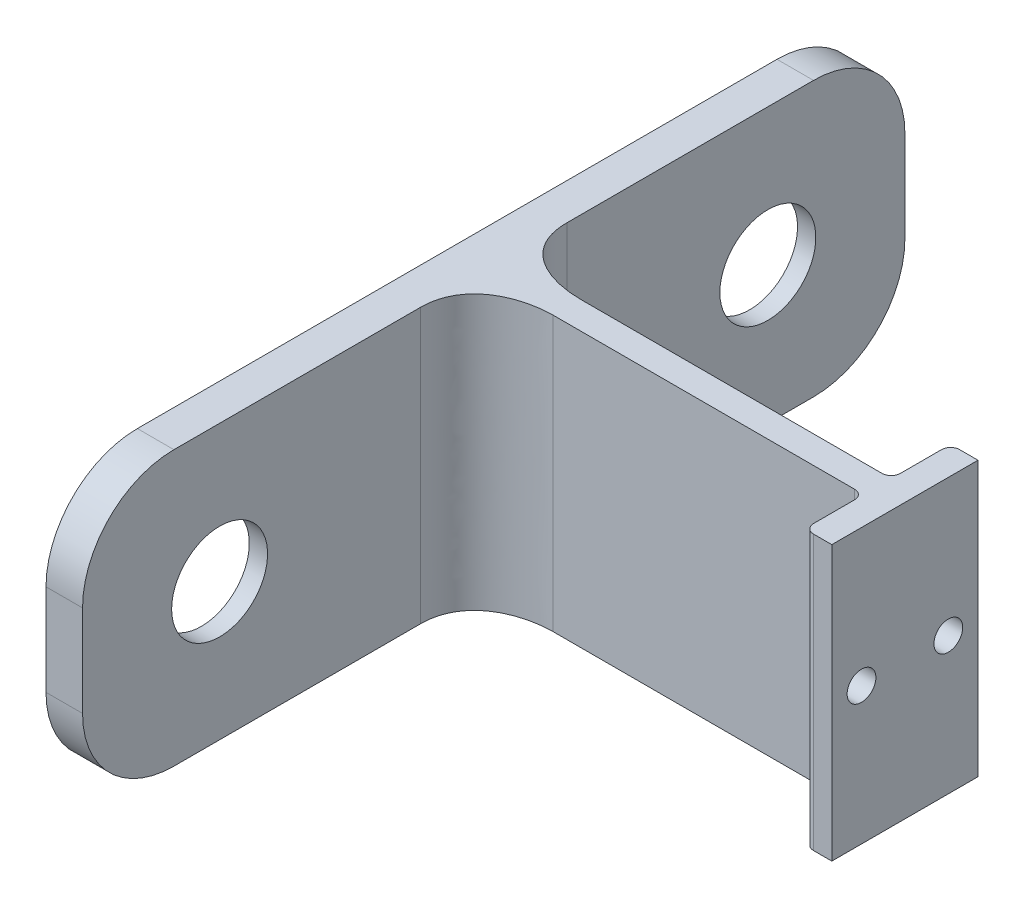
from build123d import *

# Parameters (mm, degrees)
SKETCH1_W                = 90
SKETCH1_H                = 30
BOSS_EXTRUDE1_DEPTH      = 4
FILLET1_R                = 10
SKETCH2_R                = 1.25
CUT_EXTRUDE1_DEPTH       = 48.602520942
SKETCH3_R                = 1.25
CUT_EXTRUDE2_DEPTH       = 48.602520942
SKETCH4_W                = 16
SKETCH4_H                = 30
BOSS_EXTRUDE5_DEPTH      = 3
SKETCH11_W               = 3
SKETCH11_H               = 30
BOSS_EXTRUDE6_DEPTH      = 39
SKETCH12_W               = 16
SKETCH12_H               = 30
BOSS_EXTRUDE7_DEPTH      = 3
SKETCH14_R               = 1.575
CUT_EXTRUDE7_DEPTH       = 3
SKETCH13_R               = 1.575
CUT_EXTRUDE8_DEPTH       = 3
FILLET2_R                = 5
CUT_EXTRUDE10_START      = -30
CUT_EXTRUDE10_DEPTH      = 30
CUT_EXTRUDE11_DEPTH      = 73.97944927
CUT_EXTRUDE11_DEPTH_BACK = 73.97944927
FILLET3_R                = 1
SKETCH18_R               = 11
CUT_EXTRUDE12_DEPTH      = 2
SKETCH19_R               = 11
CUT_EXTRUDE13_DEPTH      = 2
SKETCH20_R               = 5.25
CUT_EXTRUDE14_DEPTH      = 2
SKETCH21_R               = 5.25
CUT_EXTRUDE15_DEPTH      = 2


# Read off the part's stored shape, not the designer's step: Cut-Extrude10
with BuildPart() as part:
    # Sketch1 → Boss-Extrude1 (new body)
    with BuildSketch(Plane(origin=(0, 0, 0), x_dir=(0, 0, -1), z_dir=(1, 0, 0))):
        Rectangle(SKETCH1_W, SKETCH1_H)
    extrude(amount=BOSS_EXTRUDE1_DEPTH)

    # Fillet1
    fillet1_edges = [part.edges().sort_by_distance(p)[0] for p in [
        (2, -15, -45),
        (2, -15, 45),
        (2, 15, 45),
        (2, 15, -45),
    ]]
    fillet(fillet1_edges, radius=FILLET1_R)

    # Sketch2 → Cut-Extrude1 (cut, through all)
    with BuildSketch(Plane(origin=(4, 0, 0), x_dir=(0, 0, -1), z_dir=(1, 0, 0))):
        with Locations((-30, 0)):
            Circle(SKETCH2_R)
    extrude(amount=-CUT_EXTRUDE1_DEPTH, mode=Mode.SUBTRACT)

    # Sketch3 → Cut-Extrude2 (cut, through all)
    with BuildSketch(Plane(origin=(4, 0, 0), x_dir=(0, 0, -1), z_dir=(1, 0, 0))):
        with Locations((30, 0)):
            Circle(SKETCH3_R)
    extrude(amount=-CUT_EXTRUDE2_DEPTH, mode=Mode.SUBTRACT)

    # Sketch4 → Boss-Extrude5 (add)
    with BuildSketch(Plane(origin=(4, 0, 0), x_dir=(0, 0, -1), z_dir=(1, 0, 0))):
        Rectangle(SKETCH4_W, SKETCH4_H)
    extrude(amount=BOSS_EXTRUDE5_DEPTH)

    # Sketch11 → Boss-Extrude6 (add)
    with BuildSketch(Plane(origin=(7, 0, 0), x_dir=(0, 0, -1), z_dir=(1, 0, 0))):
        Rectangle(SKETCH11_W, SKETCH11_H)
    extrude(amount=BOSS_EXTRUDE6_DEPTH)

    # Sketch12 → Boss-Extrude7 (add)
    with BuildSketch(Plane(origin=(46, 0, 0), x_dir=(0, 0, -1), z_dir=(1, 0, 0))):
        Rectangle(SKETCH12_W, SKETCH12_H)
    extrude(amount=BOSS_EXTRUDE7_DEPTH)

    # Sketch14 → Cut-Extrude7 (cut)
    with BuildSketch(Plane(origin=(49, 0, 0), x_dir=(0, 0, -1), z_dir=(1, 0, 0))):
        with Locations((4.75, 0)):
            Circle(SKETCH14_R)
    extrude(amount=-CUT_EXTRUDE7_DEPTH, mode=Mode.SUBTRACT)

    # Sketch13 → Cut-Extrude8 (cut)
    with BuildSketch(Plane(origin=(49, 0, 0), x_dir=(0, 0, -1), z_dir=(1, 0, 0))):
        with Locations((-4.75, 0)):
            Circle(SKETCH13_R)
    extrude(amount=-CUT_EXTRUDE8_DEPTH, mode=Mode.SUBTRACT)

    # Fillet2
    fillet2_edges = [part.edges().sort_by_distance(p)[0] for p in [
        (7, 0, -1.5),
        (7, 0, 1.5),
    ]]
    fillet(fillet2_edges, radius=FILLET2_R)

    # Cut-Extrude10 outline → Cut-Extrude10 (cut)
    with BuildSketch(Plane.XZ.offset(15).offset(CUT_EXTRUDE10_START)):
        with BuildLine():
            add(Edge.make_bspline(
                [(12, 1.5), (8.564078645, 1.5), (4, 3.226164853), (4, 8)],
                knots=[0, 0, 0, 0, 1, 1, 1, 1], degree=3))
            ThreePointArc((12, 1.5), (8.464466094, 2.964466094), (7, 6.5))
            Line((7, 6.5), (7, 8))
            Line((7, 8), (4, 8))
        make_face()
    extrude(amount=CUT_EXTRUDE10_DEPTH, mode=Mode.SUBTRACT)

    # Sketch16 → Cut-Extrude11 (cut, two sides: drawn at the far end of the back side and taken through both)
    with BuildSketch(Plane.XZ.offset(15).offset(-CUT_EXTRUDE11_DEPTH_BACK)):
        with BuildLine():
            ThreePointArc((7, -6.5), (8.464466094, -2.964466094), (12, -1.5))
            add(Edge.make_bspline(
                [(12, -1.5), (8.564078645, -1.5), (4, -3.006580432), (4, -8)],
                knots=[0, 0, 0, 0, 1, 1, 1, 1], degree=3))
            Line((4, -8), (7, -8))
            Line((7, -8), (7, -6.5))
        make_face()
    extrude(amount=CUT_EXTRUDE11_DEPTH + CUT_EXTRUDE11_DEPTH_BACK, mode=Mode.SUBTRACT)

    # Fillet3
    fillet3_edges = [part.edges().sort_by_distance(p)[0] for p in [
        (46, 0, -1.5),
        (46, 0, 1.5),
        (46, 0, 8),
        (46, 0, -8),
    ]]
    fillet(fillet3_edges, radius=FILLET3_R)

    # Sketch18 → Cut-Extrude12 (cut)
    with BuildSketch(Plane.ZY):
        with Locations((30, 0)):
            Circle(SKETCH18_R)
    extrude(amount=-CUT_EXTRUDE12_DEPTH, mode=Mode.SUBTRACT)

    # Sketch19 → Cut-Extrude13 (cut)
    with BuildSketch(Plane.ZY):
        with Locations((-30, 0)):
            Circle(SKETCH19_R)
    extrude(amount=-CUT_EXTRUDE13_DEPTH, mode=Mode.SUBTRACT)

    # Sketch20 → Cut-Extrude14 (cut)
    with BuildSketch(Plane.ZY.offset(-2)):
        with Locations((30, 0)):
            Circle(SKETCH20_R)
    extrude(amount=-CUT_EXTRUDE14_DEPTH, mode=Mode.SUBTRACT)

    # Sketch21 → Cut-Extrude15 (cut)
    with BuildSketch(Plane.ZY.offset(-2)):
        with Locations((-30, 0)):
            Circle(SKETCH21_R)
    extrude(amount=-CUT_EXTRUDE15_DEPTH, mode=Mode.SUBTRACT)


solid = part.part
